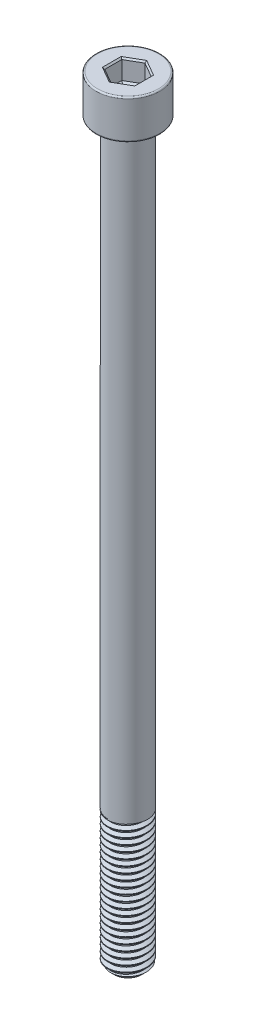
from build123d import *

# Parameters (mm, degrees)
SKETCH1_R           = 4
BOSS_EXTRUDE1_DEPTH = 28
THREAD1_PITCH       = 1.25
SKETCH2_R           = 4
BOSS_EXTRUDE2_DEPTH = 122
SKETCH5_R           = 6.5
BOSS_EXTRUDE3_DEPTH = 8
FILLET1_R           = 0.3
CUT_EXTRUDE1_DEPTH  = 4
CHAMFER1_SIZE       = 0.3
CUT_EXTRUDE2_DEPTH  = 0.4
CUT_EXTRUDE2_DRAFT  = -60


with BuildPart() as part:
    # Sketch1 → Boss-Extrude1 (new body)
    with BuildSketch(Plane(origin=(0, 0, 0), x_dir=(1, 0, 0), z_dir=(0, 1, 0))):
        with Locations(Location((0, 0, 0), (0, 0, 270))):
            Circle(SKETCH1_R)
    extrude(amount=BOSS_EXTRUDE1_DEPTH)

    # Thread1: the profile of Thread Profile1 profile screwed along a right-hand helix of 24 turns, 8 arcs to a turn; built about Z, then put on its axis
    thread1_z = Axis((0, 0, 0), (0, 0, 1))
    thread1_corners = [(4.0003, 0, -0.000173205), (4.0003, 0, 1.093923202), (3.323417656, 0, 0.703124998), (3.323417656, 0, 0.390624998)]
    with BuildLine(mode=Mode.PRIVATE) as thread1_profile:
        Line(thread1_corners[0], thread1_corners[1])
        Line(thread1_corners[1], thread1_corners[2])
        Line(thread1_corners[2], thread1_corners[3])
        Line(thread1_corners[3], thread1_corners[0])
    thread1_cap = Face(thread1_profile.wire())
    thread1_turn_angles = [0, 22.5, 45, 67.5, 90, 112.5, 135, 157.5, 180, 202.5, 225, 247.5, 270, 292.5, 315, 337.5, 360]
    thread1_turn_weights = [1, 0.9238795325112867, 1, 0.9238795325112867, 1, 0.9238795325112867, 1, 0.9238795325112867, 1, 0.9238795325112867, 1, 0.9238795325112867, 1, 0.9238795325112867, 1, 0.9238795325112867, 1]
    thread1_turn_rails = [Edge.make_bspline([Vector(p[0], p[1], 0).rotate(thread1_z, thread1_turn_angles[k]) / thread1_turn_weights[k] + Vector(0, 0, p[2] + THREAD1_PITCH * thread1_turn_angles[k] / 360) for k in range(17)], [0, 0, 0, 1, 1, 2, 2, 3, 3, 4, 4, 5, 5, 6, 6, 7, 7, 8, 8, 8], 2, thread1_turn_weights) for p in thread1_corners]
    thread1_turn_sides = [Face.make_surface_from_curves(thread1_turn_rails[p[0]], thread1_turn_rails[p[1]]) for p in [(0, 1), (1, 2), (2, 3), (3, 0)]]
    thread1 = Plane(origin=(0, 30, 0), x_dir=(-1, 0, 0), z_dir=(0, -1, 0)) * Solid(Shell([*[p.moved(Location((0, 0, THREAD1_PITCH * i))) for i in range(24) for p in thread1_turn_sides], thread1_cap, thread1_cap.rotate(thread1_z, 8640).moved(Location((0, 0, THREAD1_PITCH * 8640 / 360)))]))
    add(thread1, mode=Mode.SUBTRACT)

    # Sketch2 → Boss-Extrude2 (add)
    with BuildSketch(Plane(origin=(0, 28, 0), x_dir=(1, 0, 0), z_dir=(0, 1, 0))):
        with Locations(Location((0, 0, 0), (0, 0, 117.593571361))):
            Circle(SKETCH2_R)
    extrude(amount=BOSS_EXTRUDE2_DEPTH)

    # Sketch5 → Boss-Extrude3 (add)
    with BuildSketch(Plane(origin=(0, 150, 0), x_dir=(1, 0, 0), z_dir=(0, 1, 0))):
        with Locations(Location((0, 0, 0), (0, 0, 270))):
            Circle(SKETCH5_R)
    extrude(amount=BOSS_EXTRUDE3_DEPTH)

    # Sketch6 → Cut-Revolve1 (revolve, cut)
    with BuildSketch(Plane.XY, mode=Mode.PRIVATE) as cut_revolve1_sk:
        Polygon((4.01, 0), (4.01, 1.2), (2.81, 0), align=None)
    revolve(cut_revolve1_sk.sketch.rotate(Axis((0, 0, 0), (0, 1, 0)), 117.593571361), axis=Axis((0, 0, 0), (0, 1, 0)), mode=Mode.SUBTRACT)

    # Fillet1
    fillet1_edges = [part.edges().sort_by_distance(p)[0] for p in [
        (0, 150, -6.5),
        (0, 158, -6.5),
    ]]
    fillet(fillet1_edges, radius=FILLET1_R)

    # Sketch7 → Cut-Extrude1 (cut)
    with BuildSketch(Plane(origin=(0, 158, 0), x_dir=(1, 0, 0), z_dir=(0, 1, 0))):
        Polygon((0, 3.464101615), (-3, 1.732050808), (-3, -1.732050808), (0, -3.464101615), (3, -1.732050808), (3, 1.732050808), align=None)
    extrude(amount=-CUT_EXTRUDE1_DEPTH, mode=Mode.SUBTRACT)

    # Chamfer1
    chamfer1_edges = [part.edges().sort_by_distance(p)[0] for p in [
        (1.5, 158, -2.598076211),
        (-1.5, 158, -2.598076211),
        (-3, 158, 0),
        (-1.5, 158, 2.598076211),
        (1.5, 158, 2.598076211),
        (3, 158, 0),
    ]]
    chamfer(chamfer1_edges, length=CHAMFER1_SIZE)


with BuildPart() as cut_extrude2_tool:
    # Sketch8 → Cut-Extrude2 (with draft: the straight prism first)
    with BuildSketch(Plane(origin=(0, 154, 0), x_dir=(1, 0, 0), z_dir=(0, 1, 0))):
        Polygon((0, 3.464101615), (-3, 1.732050808), (-3, -1.732050808), (0, -3.464101615), (3, -1.732050808), (3, 1.732050808), align=None)
    extrude(amount=-CUT_EXTRUDE2_DEPTH)
    # Cut-Extrude2: the draft: its side faces are tilted about the plane it starts from
    cut_extrude2_sides = [cut_extrude2_tool.faces().sort_by_distance(p)[0] for p in [
        (-1.5, 153.8, -2.598076211),
        (-3, 153.8, 0),
        (-1.5, 153.8, 2.598076211),
        (1.5, 153.8, 2.598076211),
        (3, 153.8, 0),
        (1.5, 153.8, -2.598076211),
    ]]
    draft(cut_extrude2_sides, Plane(origin=(0, 154, 0), x_dir=(1, 0, 0), z_dir=(0, 1, 0)), CUT_EXTRUDE2_DRAFT)


with BuildPart() as part_1:
    add(part.part)

    # Cut-Extrude2: cut by cut_extrude2_tool
    add(cut_extrude2_tool.part, mode=Mode.SUBTRACT)


solid = part_1.part
